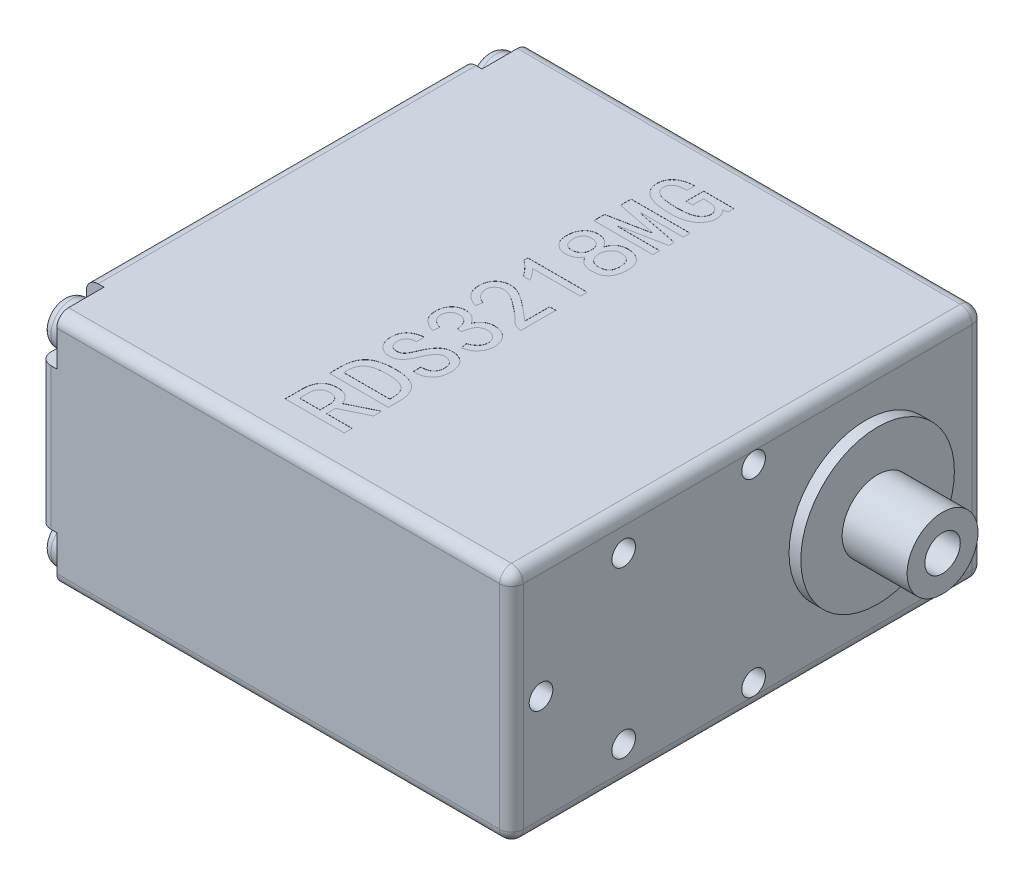
from build123d import *

# Parameters (mm, degrees)
SKETCH_1_W          = 40
SKETCH_1_H          = 40
EXTRUDE_1_DEPTH     = 20
SKETCH_3_R          = 6.5
EXTRUDE_2_DEPTH     = 1
SKETCH_4_R          = 3
EXTRUDE_3_DEPTH     = 5.5
SKETCH_5_R          = 1.5
CUT_EXTRUDE_2_DEPTH = 3.5
SKETCH_6_W          = 4
SKETCH_6_H          = 4
CUT_EXTRUDE_3_DEPTH = 1.5
FILLET_1_R          = 2
EXTRUDE_START       = -41
SKETCH_3_2_R        = 6.5
EXTRUDE_4_DEPTH     = 41
SKETCH_7_R          = 1
CUT_EXTRUDE_4_DEPTH = 5
EXTRUDE_START_2     = -46
SKETCH_4_2_R        = 3
EXTRUDE_5_DEPTH     = 46
CUT_EXTRUDE_START   = -4
SKETCH_8_R          = 1.5
CUT_EXTRUDE_5_DEPTH = 4
SKETCH_9_R          = 1.75
EXTRUDE_6_DEPTH     = 1.5
FILLET_3_R          = 0.75
FILLET_4_R          = 1
CUT_EXTRUDE_6_DEPTH = 0.01
CUT_EXTRUDE_START_2 = -5
SKETCH_11_R         = 1
CUT_EXTRUDE_7_DEPTH = 5


with BuildPart() as part:
    # 草图1 → 凸台-拉伸1 (new body)
    with BuildSketch(Plane(origin=(0, 0, 0), x_dir=(1, 0, 0), z_dir=(0, 1, 0))):
        Rectangle(SKETCH_1_W, SKETCH_1_H)
    extrude(amount=EXTRUDE_1_DEPTH)

    # 草图3 → 凸台-拉伸2 (add)
    with BuildSketch(Plane(origin=(20, 0, 0), x_dir=(0, 0, -1), z_dir=(1, 0, 0))):
        with Locations(Location((10, 10, 0), (0, 0, 180))):
            Circle(SKETCH_3_R)
    extrude(amount=EXTRUDE_2_DEPTH)

    # 草图4 → 凸台-拉伸3 (add)
    with BuildSketch(Plane(origin=(21, 0, 0), x_dir=(0, 0, -1), z_dir=(1, 0, 0))):
        with Locations((10, 10)):
            Circle(SKETCH_4_R)
    extrude(amount=EXTRUDE_3_DEPTH)

    # 草图5 → 切除-拉伸2 (cut)
    with BuildSketch(Plane(origin=(26.5, 0, 0), x_dir=(0, 0, -1), z_dir=(1, 0, 0))):
        with Locations((10, 10)):
            Circle(SKETCH_5_R)
    extrude(amount=-CUT_EXTRUDE_2_DEPTH, mode=Mode.SUBTRACT)

    # 草图6 → 切除-拉伸3 (cut)
    with BuildSketch(Plane.ZY.offset(20)):
        with Locations((18, 18)):
            Rectangle(SKETCH_6_W, SKETCH_6_H)
        with Locations((-18, 18)):
            Rectangle(SKETCH_6_W, SKETCH_6_H)
        with Locations((-18, 2)):
            Rectangle(SKETCH_6_W, SKETCH_6_H)
        with Locations((18, 2)):
            Rectangle(SKETCH_6_W, SKETCH_6_H)
    extrude(amount=-CUT_EXTRUDE_3_DEPTH, mode=Mode.SUBTRACT)

    # 圆角1
    fillet_1_edges = [part.edges().sort_by_distance(p)[0] for p in [
        (-19.25, 16, -16),
        (-19.25, 4, 16),
        (-19.25, 4, -16),
        (-19.25, 16, 16),
    ]]
    fillet(fillet_1_edges, radius=FILLET_1_R)

    # 草图3<2> → 凸台-拉伸4 (add)
    with BuildSketch(Plane(origin=(20, 0, 0), x_dir=(0, 0, -1), z_dir=(1, 0, 0)).offset(EXTRUDE_START)):
        with Locations(Location((10, 10, 0), (0, 0, 180))):
            Circle(SKETCH_3_2_R)
    extrude(amount=EXTRUDE_4_DEPTH)

    # 草图7 → 切除-拉伸4 (cut)
    with BuildSketch(Plane.ZY.offset(20)):
        with Locations(Location((-0.5, 18, 0), (0, 0, 180))):
            Circle(SKETCH_7_R)
        with Locations((17.5, 10)):
            Circle(SKETCH_7_R)
        with Locations((10.5, 17)):
            Circle(SKETCH_7_R)
        with Locations((-0.5, 2)):
            Circle(SKETCH_7_R)
        with Locations(Location((10.5, 3, 0), (0, 0, 180))):
            Circle(SKETCH_7_R)
    extrude(amount=-CUT_EXTRUDE_4_DEPTH, mode=Mode.SUBTRACT)

    # 草图4<2> → 凸台-拉伸5 (add)
    with BuildSketch(Plane(origin=(21, 0, 0), x_dir=(0, 0, -1), z_dir=(1, 0, 0)).offset(EXTRUDE_START_2)):
        with Locations((10, 10)):
            Circle(SKETCH_4_2_R)
    extrude(amount=EXTRUDE_5_DEPTH)

    # 草图8 → 切除-拉伸5 (cut)
    with BuildSketch(Plane.ZY.offset(25).offset(CUT_EXTRUDE_START)):
        with Locations(Location((-10, 10, 0), (0, 0, 180))):
            Circle(SKETCH_8_R)
    extrude(amount=CUT_EXTRUDE_5_DEPTH, mode=Mode.SUBTRACT)

    # 草图9 → 凸台-拉伸6 (add)
    with BuildSketch(Plane.ZY.offset(18.5)):
        with Locations(Location((-18, 18, 0), (0, 0, 180))):
            Circle(SKETCH_9_R)
        with Locations(Location((-18, 2, 0), (0, 0, 180))):
            Circle(SKETCH_9_R)
        with Locations(Location((18, 2, 0), (0, 0, 180))):
            Circle(SKETCH_9_R)
        with Locations(Location((18, 18, 0), (0, 0, 180))):
            Circle(SKETCH_9_R)
    extrude(amount=EXTRUDE_6_DEPTH)

    # 圆角3
    fillet_3_edges = [part.edges().sort_by_distance(p)[0] for p in [
        (-20, 18, -16.25),
        (-20, 2, -16.25),
        (-20, 2, 19.75),
        (-20, 18, 19.75),
    ]]
    fillet(fillet_3_edges, radius=FILLET_3_R)

    # 圆角4
    fillet_4_edges = [part.edges().sort_by_distance(p)[0] for p in [
        (0.75, 0, 20),
        (-20, 0, 0),
        (-20, 20, 0),
        (0.75, 20, 20),
        (-20, 10, 20),
        (-20, 10, -20),
        (20, 20, 0),
        (0.75, 0, -20),
        (20, 0, 0),
        (0.75, 20, -20),
        (20, 10, 20),
        (20, 10, -20),
    ]]
    fillet(fillet_4_edges, radius=FILLET_4_R - 0.0001)  # a hair under: the kernel refuses the full size

    # 草图10 → 切除-拉伸6 (cut)
    # profile 1 of 9: a face of its own
    with BuildSketch(Plane(origin=(0, 20, 0), x_dir=(1, 0, 0), z_dir=(0, 1, 0))):
        with BuildLine():
            Line((2.35380117, -13.333333333), (2.35380117, -14.035087719))
            Line((2.35380117, -14.035087719), (0.19005848, -15.087719298))
            Line((0.19005848, -15.087719298), (0.19005848, -15.847953216))
            Line((0.19005848, -15.847953216), (2.35380117, -15.847953216))
            Line((2.35380117, -15.847953216), (2.35380117, -16.520467836))
            Line((2.35380117, -16.520467836), (-2.64619883, -16.520467836))
            Line((-2.64619883, -16.520467836), (-2.64619883, -15.058479532))
            add(Edge.make_bspline(
                [(-2.64619883, -15.058479532), (-2.645066198, -15.001417536), (-2.642847015, -14.88961512), (-2.628216129, -14.725857534), (-2.60076945, -14.570699353), (-2.563921503, -14.423736755), (-2.517830493, -14.284631505), (-2.459967458, -14.153843609), (-2.391750222, -14.031104197), (-2.312793325, -13.916867195), (-2.222078827, -13.812934167), (-2.116562598, -13.723592122), (-1.998633781, -13.646805994), (-1.86677698, -13.585513412), (-1.72205374, -13.537752248), (-1.564232247, -13.503367145), (-1.393046397, -13.482767178), (-1.274515513, -13.480632114), (-1.213450292, -13.479532164)],
                knots=[0, 0, 0, 0, 1.124630092, 2.203504408, 3.23628662, 4.226715629, 5.187363728, 6.120646134, 7.041068246, 7.950871023, 8.853048098, 9.751261271, 10.666886757, 11.618456078, 12.60834836, 13.664751565, 14.796917252, 16, 16, 16, 16], degree=3))
            add(Edge.make_bspline(
                [(-1.213450292, -13.479532164), (-1.166121865, -13.48022125), (-1.073769469, -13.48156587), (-0.939504453, -13.496127483), (-0.813445664, -13.518511456), (-0.695494663, -13.549827176), (-0.585670205, -13.590688468), (-0.484439599, -13.642258608), (-0.390710508, -13.701512797), (-0.27965188, -13.792391704), (-0.159447869, -13.917911637), (-0.040468237, -14.081787414), (0.049701913, -14.257491627), (0.084854111, -14.382342379), (0.102339181, -14.444444444)],
                knots=[0, 0, 0, 0, 0.960252019, 1.873748618, 2.737466876, 3.556786617, 4.347431233, 5.110891588, 5.858830743, 6.593445102, 8.018399741, 9.372640647, 10.693124067, 12, 12, 12, 12], degree=3))
            Line((0.102339181, -14.444444444), (2.35380117, -13.333333333))
        make_face()
        with BuildLine():
            add(Edge.make_bspline(
                [(-1.213450292, -14.152046784), (-1.246682501, -14.153044192), (-1.311517879, -14.154990115), (-1.40628781, -14.165326916), (-1.495081675, -14.184974683), (-1.57880875, -14.211992032), (-1.656320325, -14.248268559), (-1.729981475, -14.289848941), (-1.79618772, -14.342134507), (-1.858466405, -14.400302894), (-1.914187461, -14.467550402), (-1.960853018, -14.545455285), (-2.002289841, -14.63138005), (-2.033997711, -14.728102137), (-2.060767511, -14.833232476), (-2.076405078, -14.948776312), (-2.089718369, -15.073337123), (-2.090327756, -15.159873101), (-2.090643275, -15.204678363)],
                knots=[0, 0, 0, 0, 1.018570254, 1.987210327, 2.915804621, 3.800751041, 4.676804698, 5.534297136, 6.386063351, 7.254542914, 8.142525653, 9.051209436, 10.030838938, 11.059211408, 12.164478139, 13.350221964, 14.628038851, 16, 16, 16, 16], degree=3))
            Line((-2.090643275, -15.204678363), (-2.090643275, -15.847953216))
            Line((-2.090643275, -15.847953216), (-0.365497076, -15.847953216))
            Line((-0.365497076, -15.847953216), (-0.365497076, -15.029239766))
            add(Edge.make_bspline(
                [(-0.365497076, -15.029239766), (-0.367682863, -14.972375244), (-0.371961019, -14.861076479), (-0.408561283, -14.699995634), (-0.469374047, -14.550397153), (-0.537978064, -14.43513158), (-0.606367302, -14.351854594), (-0.668180836, -14.298912037), (-0.737022381, -14.252190422), (-0.81600611, -14.216050211), (-0.902999543, -14.186509981), (-0.99896802, -14.166316218), (-1.103417182, -14.154590017), (-1.175876201, -14.152915247), (-1.213450292, -14.152046784)],
                knots=[0, 0, 0, 0, 1.472377943, 2.88182931, 4.254250842, 5.643689461, 6.340829676, 7.036964823, 7.745313799, 8.490218866, 9.280116125, 10.122350202, 11.026332609, 12, 12, 12, 12], degree=3))
        make_face(mode=Mode.SUBTRACT)
    # profile 2 of 9: a face of its own
    with BuildSketch(Plane(origin=(0, 20, 0), x_dir=(1, 0, 0), z_dir=(0, 1, 0))):
        with BuildLine():
            add(Edge.make_bspline(
                [(-0.131578947, -9.678362573), (-0.023577985, -9.679780731), (0.184848114, -9.682517569), (0.485455921, -9.71024761), (0.76236218, -9.753162291), (1.014962479, -9.815989188), (1.243581941, -9.895387348), (1.448299187, -9.99296932), (1.629215559, -10.109052702), (1.784721025, -10.245156151), (1.919973898, -10.394710464), (2.036411963, -10.556857624), (2.134245795, -10.731448581), (2.214795848, -10.917957904), (2.27775706, -11.116755185), (2.32147745, -11.328330592), (2.349429023, -11.551845477), (2.352321907, -11.705205676), (2.35380117, -11.783625731)],
                knots=[0, 0, 0, 0, 1.389657691, 2.681836576, 3.8817881, 4.992838363, 6.027306203, 6.991498475, 7.90517149, 8.78454697, 9.643055887, 10.495319185, 11.348215431, 12.21388539, 13.105788495, 14.027025635, 14.991128354, 16, 16, 16, 16], degree=3))
            Line((2.35380117, -11.783625731), (2.35380117, -12.777777778))
            Line((2.35380117, -12.777777778), (-2.64619883, -12.777777778))
            Line((-2.64619883, -12.777777778), (-2.64619883, -11.783625731))
            add(Edge.make_bspline(
                [(-2.64619883, -11.783625731), (-2.644869431, -11.696177373), (-2.642296474, -11.526927372), (-2.613114569, -11.282510096), (-2.568620109, -11.055695287), (-2.504704159, -10.846527583), (-2.422775377, -10.654576328), (-2.321024538, -10.481150784), (-2.202753809, -10.324161201), (-2.062896976, -10.186366574), (-1.902800454, -10.064524022), (-1.718954316, -9.96052171), (-1.511462849, -9.873388174), (-1.28136339, -9.800820191), (-1.027032006, -9.746543263), (-0.749840186, -9.707428888), (-0.448645745, -9.681640688), (-0.239931227, -9.679482814), (-0.131578947, -9.678362573)],
                knots=[0, 0, 0, 0, 1.107747103, 2.143964784, 3.114763989, 4.033695075, 4.910753596, 5.753467216, 6.57607144, 7.394530573, 8.233597708, 9.118827463, 10.063766083, 11.080943166, 12.172147419, 13.355508743, 14.627135957, 16, 16, 16, 16], degree=3))
        make_face()
        with BuildLine():
            add(Edge.make_bspline(
                [(-0.131578947, -10.380116959), (-0.218237435, -10.38111375), (-0.385220364, -10.383034475), (-0.626086424, -10.398812973), (-0.846560545, -10.426998261), (-1.047759136, -10.463942891), (-1.228075597, -10.513528553), (-1.389433753, -10.572459765), (-1.530225594, -10.644024539), (-1.652311582, -10.726936665), (-1.756527104, -10.821632279), (-1.846483809, -10.926760749), (-1.922182862, -11.043033022), (-1.984880989, -11.170120005), (-2.031714575, -11.308343356), (-2.066758482, -11.456922813), (-2.0873857, -11.616630383), (-2.089536538, -11.726890313), (-2.090643275, -11.783625731)],
                knots=[0, 0, 0, 0, 1.502629547, 2.895428823, 4.182716366, 5.355134258, 6.439418811, 7.421876653, 8.328913812, 9.170986823, 9.973119587, 10.763417097, 11.563789401, 12.372828843, 13.214157028, 14.088710487, 15.016525688, 16, 16, 16, 16], degree=3))
            Line((-2.090643275, -11.783625731), (-2.090643275, -12.105263158))
            Line((-2.090643275, -12.105263158), (1.798245614, -12.105263158))
            Line((1.798245614, -12.105263158), (1.798245614, -11.783625731))
            add(Edge.make_bspline(
                [(1.798245614, -11.783625731), (1.797037417, -11.726900309), (1.794690361, -11.616704886), (1.77547297, -11.456986095), (1.741514454, -11.30838016), (1.695603378, -11.17040291), (1.635112532, -11.043472693), (1.562980154, -10.9265082), (1.475018571, -10.822057849), (1.374311069, -10.727281394), (1.256212201, -10.64374175), (1.11822836, -10.571969558), (0.959017125, -10.513994768), (0.780757536, -10.463533345), (0.581566556, -10.427180458), (0.362233175, -10.398635855), (0.122056884, -10.383071347), (-0.044922368, -10.381126348), (-0.131578947, -10.380116959)],
                knots=[0, 0, 0, 0, 0.990994579, 1.925116862, 2.804934476, 3.650652139, 4.460393816, 5.25668448, 6.044890256, 6.839230022, 7.667046998, 8.564215713, 9.54828102, 10.622625477, 11.79781265, 13.082430897, 14.485880397, 16, 16, 16, 16], degree=3))
        make_face(mode=Mode.SUBTRACT)
    # profile 3 of 9: a face of its own
    with BuildSketch(Plane(origin=(0, 20, 0), x_dir=(1, 0, 0), z_dir=(0, 1, 0))):
        with BuildLine():
            add(Edge.make_bspline(
                [(0.950292398, -5.964912281), (1.00485854, -5.96611488), (1.111466606, -5.968464446), (1.267472591, -5.988166817), (1.414760107, -6.021503035), (1.553448077, -6.06825243), (1.683094542, -6.128100931), (1.804424941, -6.200953946), (1.91633904, -6.288289738), (2.018952876, -6.388180434), (2.112355229, -6.498191143), (2.19303605, -6.619206579), (2.259934873, -6.750502322), (2.316857499, -6.890417298), (2.35986733, -7.040408842), (2.389890431, -7.199945885), (2.408513647, -7.368702801), (2.411006417, -7.484609197), (2.412280702, -7.543859649)],
                knots=[0, 0, 0, 0, 1.076259056, 2.102730573, 3.09615591, 4.05107809, 4.984729369, 5.908110826, 6.836941787, 7.778787535, 8.728970618, 9.679073625, 10.641034314, 11.631596305, 12.654875673, 13.713625689, 14.831223164, 16, 16, 16, 16], degree=3))
            add(Edge.make_bspline(
                [(2.412280702, -7.543859649), (2.411118334, -7.603120113), (2.408850742, -7.718727644), (2.38878598, -7.88674787), (2.357655679, -8.045189145), (2.3139041, -8.194014781), (2.2549891, -8.332074593), (2.183677057, -8.459782074), (2.101938164, -8.57922208), (2.004586978, -8.685119052), (1.900584886, -8.782271632), (1.786821893, -8.864048438), (1.668559855, -8.935622207), (1.542930542, -8.992730237), (1.411659678, -9.03917607), (1.273013844, -9.069588416), (1.128510581, -9.090121752), (1.029783608, -9.092405061), (0.979532164, -9.093567251)],
                knots=[0, 0, 0, 0, 1.196484868, 2.334147444, 3.412243803, 4.454848227, 5.460999767, 6.436818592, 7.405612426, 8.376187812, 9.335968902, 10.275091469, 11.200357791, 12.123553648, 13.057369033, 14.007128931, 14.985640427, 16, 16, 16, 16], degree=3))
            Line((0.979532164, -9.093567251), (0.774853801, -9.093567251))
            Line((0.774853801, -9.093567251), (0.774853801, -8.421052632))
            Line((0.774853801, -8.421052632), (0.950292398, -8.421052632))
            add(Edge.make_bspline(
                [(0.950292398, -8.421052632), (0.985698023, -8.420147541), (1.054908927, -8.418378271), (1.155425702, -8.406781459), (1.249766199, -8.386069145), (1.337249456, -8.357023599), (1.4187542, -8.31984787), (1.493437116, -8.274173623), (1.562626415, -8.220916991), (1.643542975, -8.138666558), (1.728934814, -8.025256564), (1.802805101, -7.874583404), (1.849618032, -7.71305959), (1.854331152, -7.600853757), (1.856725146, -7.543859649)],
                knots=[0, 0, 0, 0, 0.89970853, 1.758749939, 2.566656616, 3.349866332, 4.096893782, 4.837870496, 5.569993442, 6.309435511, 7.764284211, 9.154994143, 10.554900695, 12, 12, 12, 12], degree=3))
            add(Edge.make_bspline(
                [(1.856725146, -7.543859649), (1.855714381, -7.506301565), (1.853746926, -7.433194718), (1.843733681, -7.327225283), (1.823769383, -7.229141747), (1.797655303, -7.138586208), (1.760654892, -7.056921572), (1.719404916, -6.981256191), (1.667599464, -6.914684931), (1.589742934, -6.8377836), (1.481175834, -6.756534603), (1.334710767, -6.68810274), (1.175798739, -6.645084756), (1.065364738, -6.640021571), (1.00877193, -6.637426901)],
                knots=[0, 0, 0, 0, 0.962440328, 1.873391043, 2.722138851, 3.523734004, 4.281456455, 5.014396504, 5.726506092, 6.432706956, 7.814287824, 9.175195494, 10.55240578, 12, 12, 12, 12], degree=3))
            add(Edge.make_bspline(
                [(1.00877193, -6.637426901), (0.984535944, -6.638321778), (0.936495508, -6.640095599), (0.864891644, -6.652538514), (0.794582363, -6.672804115), (0.72606315, -6.70293156), (0.658379078, -6.739349847), (0.593437366, -6.786165217), (0.528032445, -6.83861447), (0.442556664, -6.924003205), (0.339020088, -7.050093624), (0.223658349, -7.227045396), (0.112980987, -7.432538058), (0.048455468, -7.582291642), (0.014619883, -7.660818713)],
                knots=[0, 0, 0, 0, 0.578138014, 1.145981947, 1.729294273, 2.319686506, 2.928759201, 3.559612696, 4.226874004, 4.927334085, 6.438251822, 8.110552943, 9.960470262, 12, 12, 12, 12], degree=3))
            add(Edge.make_bspline(
                [(0.014619883, -7.660818713), (-0.007413061, -7.717272088), (-0.050196092, -7.826891868), (-0.118263453, -7.984293858), (-0.188572515, -8.129059675), (-0.259747086, -8.262342254), (-0.334452161, -8.382045147), (-0.410204365, -8.490263285), (-0.488379395, -8.585467988), (-0.567277334, -8.670325205), (-0.651027636, -8.741873847), (-0.736146032, -8.805885189), (-0.827006101, -8.857393596), (-0.920155764, -8.901268775), (-1.017390163, -8.935264017), (-1.118412192, -8.958386413), (-1.22302232, -8.974853892), (-1.294244549, -8.976017392), (-1.330409357, -8.976608187)],
                knots=[0, 0, 0, 0, 1.442752318, 2.801501104, 4.081506638, 5.273637195, 6.396923968, 7.438988766, 8.41619664, 9.328106494, 10.193211603, 11.035517752, 11.859560831, 12.674726742, 13.484711172, 14.306060706, 15.139861387, 16, 16, 16, 16], degree=3))
            add(Edge.make_bspline(
                [(-1.330409357, -8.976608187), (-1.380284474, -8.975377993), (-1.478262293, -8.972961322), (-1.621730455, -8.953423084), (-1.757763822, -8.919681471), (-1.886403921, -8.873076414), (-2.007564401, -8.81287286), (-2.121712644, -8.7401068), (-2.228798605, -8.653970415), (-2.32612389, -8.554577048), (-2.414370853, -8.446563007), (-2.493088201, -8.333109871), (-2.55800361, -8.213322442), (-2.611257311, -8.088881067), (-2.654171435, -7.960128601), (-2.68257172, -7.825658162), (-2.702321989, -7.68667463), (-2.703885017, -7.591942723), (-2.704678363, -7.543859649)],
                knots=[0, 0, 0, 0, 1.07870255, 2.119071136, 3.124805643, 4.105581286, 5.072990272, 6.045680189, 7.028691787, 8.039235481, 9.049145311, 10.043383937, 11.021887354, 11.990902522, 12.968844852, 13.952259623, 14.960628413, 16, 16, 16, 16], degree=3))
            add(Edge.make_bspline(
                [(-2.704678363, -7.543859649), (-2.703083565, -7.482805017), (-2.699988318, -7.36430774), (-2.680226812, -7.193274654), (-2.644116665, -7.035471601), (-2.594664834, -6.891162209), (-2.531411981, -6.759095893), (-2.453710418, -6.640480594), (-2.359864682, -6.53622945), (-2.253597636, -6.445989702), (-2.13916413, -6.368207311), (-2.021751086, -6.299782766), (-1.902859991, -6.240504808), (-1.780662385, -6.194220659), (-1.65689007, -6.157278217), (-1.530720648, -6.129436609), (-1.401881322, -6.114627277), (-1.315281091, -6.112284089), (-1.271929825, -6.111111111)],
                knots=[0, 0, 0, 0, 1.28200282, 2.488162422, 3.607876601, 4.67451564, 5.684699519, 6.674808952, 7.640986039, 8.619275895, 9.594772521, 10.542429609, 11.471197476, 12.380494384, 13.282146407, 14.18153381, 15.089692832, 16, 16, 16, 16], degree=3))
            Line((-1.271929825, -6.111111111), (-1.271929825, -6.783625731))
            add(Edge.make_bspline(
                [(-1.271929825, -6.783625731), (-1.324389139, -6.781468195), (-1.427721868, -6.777218347), (-1.580618678, -6.808500188), (-1.725651683, -6.868000385), (-1.837506635, -6.94078496), (-1.919158232, -7.011373105), (-1.972590761, -7.071743361), (-2.018248401, -7.136650001), (-2.05591827, -7.207501909), (-2.084702391, -7.283977545), (-2.105459109, -7.366058563), (-2.117257973, -7.453269895), (-2.11899288, -7.513140654), (-2.119883041, -7.543859649)],
                knots=[0, 0, 0, 0, 1.460277153, 2.876408615, 4.312700685, 5.812754337, 6.576349981, 7.318184748, 8.055769063, 8.785612399, 9.550601407, 10.329777546, 11.143028139, 12, 12, 12, 12], degree=3))
            add(Edge.make_bspline(
                [(-2.119883041, -7.543859649), (-2.117912687, -7.599689601), (-2.114156338, -7.706125697), (-2.077156908, -7.856386377), (-2.019108835, -7.98968196), (-1.934326459, -8.102305581), (-1.829935851, -8.193079686), (-1.707240157, -8.258806495), (-1.567676217, -8.297143337), (-1.469271557, -8.301716698), (-1.418128655, -8.304093567)],
                knots=[0, 0, 0, 0, 1.145196218, 2.183240533, 3.159303635, 4.113187715, 5.054501613, 5.980375362, 6.950360008, 8, 8, 8, 8], degree=3))
            add(Edge.make_bspline(
                [(-1.418128655, -8.304093567), (-1.375700361, -8.302409529), (-1.292581739, -8.299110435), (-1.172951859, -8.267588439), (-1.062618693, -8.216846833), (-0.97690663, -8.157567914), (-0.912807751, -8.092846525), (-0.861913417, -8.028047387), (-0.809403008, -7.947041753), (-0.75283445, -7.851016604), (-0.696615488, -7.737638923), (-0.635166794, -7.610139516), (-0.574191817, -7.465373045), (-0.533201182, -7.363426583), (-0.511695906, -7.30994152)],
                knots=[0, 0, 0, 0, 1.054599539, 2.066000132, 3.055236876, 4.067595311, 4.639532213, 5.317449549, 6.115078722, 7.04144999, 8.090482295, 9.264325581, 10.564759249, 12, 12, 12, 12], degree=3))
            add(Edge.make_bspline(
                [(-0.511695906, -7.30994152), (-0.489755884, -7.257762352), (-0.446721819, -7.155415974), (-0.37591494, -7.008182126), (-0.303081676, -6.869067852), (-0.224490791, -6.741014846), (-0.145735138, -6.620389737), (-0.062008935, -6.510127938), (0.024243394, -6.408031824), (0.114322527, -6.315699418), (0.207354659, -6.233091816), (0.303660359, -6.160934423), (0.404352753, -6.101457799), (0.506775412, -6.050940109), (0.613440262, -6.013078317), (0.722356154, -5.984556711), (0.835350808, -5.967960475), (0.911613805, -5.965938018), (0.950292398, -5.964912281)],
                knots=[0, 0, 0, 0, 1.28605471, 2.522520843, 3.711463364, 4.852377266, 5.935318125, 6.983656505, 7.996177383, 8.970703677, 9.912147403, 10.821044325, 11.700288743, 12.566114681, 13.412010411, 14.26751643, 15.121329739, 16, 16, 16, 16], degree=3))
        make_face()
    # profile 4 of 9: a face of its own
    with BuildSketch(Plane(origin=(0, 20, 0), x_dir=(1, 0, 0), z_dir=(0, 1, 0))):
        with BuildLine():
            Line((1.067251462, -5.321637427), (0.979532164, -4.795321637))
            add(Edge.make_bspline(
                [(0.979532164, -4.795321637), (1.040853083, -4.77458413), (1.161295636, -4.733852869), (1.327486639, -4.645680714), (1.477782778, -4.541050374), (1.588777988, -4.438737427), (1.666729063, -4.348632281), (1.71726486, -4.276648122), (1.758371928, -4.200080093), (1.792460809, -4.119777769), (1.817000647, -4.034595966), (1.834538636, -3.945867524), (1.843187751, -3.85297639), (1.842552646, -3.75772343), (1.836042517, -3.662592155), (1.818507918, -3.57065777), (1.791362964, -3.483921341), (1.755498343, -3.402137952), (1.710613007, -3.325316234), (1.656199122, -3.253946739), (1.592967593, -3.18710736), (1.520585208, -3.127556227), (1.443048364, -3.073608141), (1.362004123, -3.02695469), (1.278271938, -2.988758991), (1.191516928, -2.959311434), (1.102032249, -2.93753022), (1.009500324, -2.924951081), (0.914607187, -2.919110144), (0.818620832, -2.922839376), (0.723587996, -2.933056188), (0.632845465, -2.952352255), (0.547724184, -2.980305819), (0.466669657, -3.012585156), (0.393230385, -3.057122832), (0.324231957, -3.107285436), (0.259692152, -3.164442993), (0.202298297, -3.231863899), (0.148592269, -3.306784728), (0.100815145, -3.392857104), (0.057150423, -3.489104746), (0.015527629, -3.59505535), (-0.019684698, -3.712293549), (-0.052029928, -3.839433341), (-0.080334432, -3.977472679), (-0.094839944, -4.073276951), (-0.102339181, -4.122807018)],
                knots=[0, 0, 0, 0, 1.855078653, 3.643624569, 5.376586594, 7.099238453, 7.958802739, 8.792187672, 9.617290314, 10.448418756, 11.290832904, 12.156307055, 13.040730742, 13.962699908, 14.887516369, 15.77333433, 16.641593851, 17.490416695, 18.330790169, 19.188542279, 20.060501787, 20.965080398, 21.873151946, 22.768728957, 23.644924134, 24.509778096, 25.394201783, 26.283465696, 27.186203618, 28.119049805, 29.036526799, 29.926454184, 30.774960904, 31.606089347, 32.423351114, 33.231435438, 34.053018946, 34.890129815, 35.76681476, 36.694527615, 37.709623907, 38.798474327, 39.958427676, 41.219700661, 42.562606768, 44, 44, 44, 44], degree=3))
            Line((-0.102339181, -4.122807018), (-0.48245614, -4.122807018))
            add(Edge.make_bspline(
                [(-0.48245614, -4.122807018), (-0.487516128, -4.073251238), (-0.497310882, -3.977324785), (-0.523255395, -3.839475074), (-0.552474258, -3.711811329), (-0.589599866, -3.594893926), (-0.632857019, -3.488332781), (-0.682008335, -3.391702359), (-0.739035669, -3.306193061), (-0.802047005, -3.231180783), (-0.870547809, -3.16558538), (-0.944524899, -3.110237664), (-1.023201527, -3.064088441), (-1.107255194, -3.028056183), (-1.19651878, -3.002651898), (-1.290316911, -2.98440715), (-1.389553119, -2.979053083), (-1.491347971, -2.980812291), (-1.592435081, -2.992073615), (-1.687993202, -3.014888277), (-1.776490988, -3.04735127), (-1.857917244, -3.090021636), (-1.931779851, -3.143408885), (-1.998396402, -3.206820464), (-2.057253692, -3.280094112), (-2.107535735, -3.36222504), (-2.149348693, -3.449730603), (-2.180589354, -3.540299419), (-2.203419097, -3.631530575), (-2.211905558, -3.724775769), (-2.214276215, -3.819162001), (-2.202304303, -3.914924144), (-2.181705757, -4.01215967), (-2.150697784, -4.110240554), (-2.106996584, -4.207834061), (-2.043804921, -4.299281078), (-1.964580453, -4.385322091), (-1.869758442, -4.466772146), (-1.758082053, -4.54233785), (-1.63099219, -4.613727463), (-1.487278204, -4.680158408), (-1.384151092, -4.717422824), (-1.330409357, -4.736842105)],
                knots=[0, 0, 0, 0, 1.384904895, 2.680797605, 3.898481124, 5.025753962, 6.088535907, 7.094446959, 8.035691871, 8.940735056, 9.814263137, 10.667710111, 11.504637003, 12.345769282, 13.203634476, 14.081938957, 14.997613137, 15.961715347, 16.911967593, 17.820346329, 18.687619951, 19.527492825, 20.369044487, 21.214182322, 22.078195068, 22.975407077, 23.887109161, 24.769878753, 25.636861724, 26.495079393, 27.368665175, 28.257920369, 29.171665826, 30.130630594, 31.114502293, 32.133754395, 33.206966894, 34.360276363, 35.602386471, 36.951150767, 38.411179701, 40, 40, 40, 40], degree=3))
            Line((-1.330409357, -4.736842105), (-1.418128655, -5.263157895))
            add(Edge.make_bspline(
                [(-1.418128655, -5.263157895), (-1.50285585, -5.23255113), (-1.667648742, -5.173021515), (-1.899176519, -5.060340934), (-2.108901566, -4.931714425), (-2.266826242, -4.809747201), (-2.38024021, -4.703042261), (-2.453174751, -4.614438222), (-2.519978781, -4.520993956), (-2.573675278, -4.418432957), (-2.623022729, -4.311185259), (-2.658777621, -4.195516433), (-2.687136693, -4.073932299), (-2.706233064, -3.947147048), (-2.716386932, -3.819419134), (-2.720503692, -3.693909022), (-2.714195482, -3.572450382), (-2.703410731, -3.45467399), (-2.682314937, -3.341464037), (-2.654098062, -3.232531824), (-2.618456961, -3.127471153), (-2.575244782, -3.026685612), (-2.524696032, -2.931639206), (-2.46704772, -2.843858248), (-2.403850118, -2.762548186), (-2.333762123, -2.689335832), (-2.256873163, -2.623268143), (-2.173278433, -2.565460093), (-2.08457911, -2.512490792), (-1.988924829, -2.470042146), (-1.889560901, -2.433830142), (-1.786751035, -2.407570425), (-1.682029946, -2.386977791), (-1.574988311, -2.377912716), (-1.465658961, -2.376737502), (-1.354143933, -2.384447158), (-1.240187569, -2.400978176), (-1.124774719, -2.425354125), (-1.009433174, -2.460439852), (-0.897255756, -2.510958597), (-0.788877709, -2.57516873), (-0.68413977, -2.652950159), (-0.583143645, -2.744180214), (-0.487157738, -2.850217613), (-0.393174716, -2.968499453), (-0.336313367, -3.054900226), (-0.307017544, -3.099415205)],
                knots=[0, 0, 0, 0, 2.088305792, 4.061717729, 5.960118031, 7.785667395, 8.679819981, 9.565306567, 10.443279967, 11.338686075, 12.245759712, 13.17780002, 14.140475078, 15.139878761, 16.14808178, 17.111266441, 18.049939504, 18.967196016, 19.852365876, 20.717469786, 21.575331482, 22.422958398, 23.258255538, 24.068719648, 24.855928783, 25.643538544, 26.415460609, 27.202892339, 27.998428211, 28.807767097, 29.626107288, 30.44859165, 31.266374841, 32.098687341, 32.935996238, 33.800370547, 34.688426344, 35.604765293, 36.534282549, 37.478762814, 38.450894383, 39.450613662, 40.499873289, 41.602080565, 42.764555818, 44, 44, 44, 44], degree=3))
            add(Edge.make_bspline(
                [(-0.307017544, -3.099415205), (-0.276197909, -3.034005345), (-0.215772048, -2.905760897), (-0.09185367, -2.735882709), (0.051215644, -2.58790009), (0.189547779, -2.486752306), (0.310022088, -2.4179997), (0.408818634, -2.377402547), (0.514374453, -2.3455473), (0.626495071, -2.32349364), (0.745574275, -2.308951428), (0.871246009, -2.305428343), (1.00368094, -2.309517513), (1.140755816, -2.32391976), (1.278446327, -2.346146552), (1.411318621, -2.382529096), (1.537221358, -2.428925624), (1.656760642, -2.486444059), (1.768249562, -2.557566055), (1.873699408, -2.639145725), (1.972993446, -2.731357913), (2.062884732, -2.83529997), (2.14451907, -2.945626292), (2.21584892, -3.060914285), (2.27365698, -3.180869114), (2.323641987, -3.302896615), (2.358838266, -3.4298954), (2.38422144, -3.559850289), (2.39675333, -3.694025222), (2.399005857, -3.830185023), (2.39008011, -3.965897036), (2.372301225, -4.098623452), (2.342337541, -4.226140421), (2.305061051, -4.350287468), (2.254478061, -4.46845784), (2.196542905, -4.583362837), (2.125827411, -4.691837529), (2.047866418, -4.796786406), (1.958835318, -4.894610498), (1.859717443, -4.983175938), (1.752479565, -5.064795533), (1.633041509, -5.132827928), (1.506114872, -5.195982065), (1.368125324, -5.246697388), (1.221535497, -5.291143284), (1.119446966, -5.311321018), (1.067251462, -5.321637427)],
                knots=[0, 0, 0, 0, 1.557114555, 3.052923452, 4.512541953, 5.983154409, 6.732881782, 7.500995393, 8.282110219, 9.108513416, 9.963529293, 10.867588124, 11.818354446, 12.820472793, 13.839758526, 14.824163732, 15.787764911, 16.731807427, 17.680465688, 18.635497699, 19.605405708, 20.598981779, 21.596001798, 22.564501398, 23.518961515, 24.46633988, 25.40571168, 26.357402795, 27.319996089, 28.309319355, 29.292707151, 30.252143978, 31.194996855, 32.116404031, 33.045091025, 33.964751706, 34.88951078, 35.835094381, 36.78343283, 37.737543287, 38.700262624, 39.68479108, 40.698496387, 41.755992226, 42.852690736, 44, 44, 44, 44], degree=3))
        make_face()
    # profile 5 of 9: a face of its own
    with BuildSketch(Plane(origin=(0, 20, 0), x_dir=(1, 0, 0), z_dir=(0, 1, 0))):
        with BuildLine():
            add(Edge.make_bspline(
                [(2.207602339, -1.520467836), (2.171383898, -1.516930761), (2.099397912, -1.509900644), (1.993497133, -1.485214985), (1.89010043, -1.450480451), (1.789254163, -1.404783216), (1.690917441, -1.348358867), (1.597172337, -1.278955449), (1.503886772, -1.20145456), (1.415716669, -1.108769119), (1.321899694, -1.00883811), (1.214531083, -0.905312228), (1.097240736, -0.793260154), (0.965186118, -0.676629277), (0.822026801, -0.552619503), (0.666516001, -0.42217404), (0.498601542, -0.285751696), (0.321756749, -0.14644124), (0.145009606, -0.008822175), (-0.026284385, 0.117073136), (-0.185341731, 0.232743571), (-0.334410007, 0.334927391), (-0.474459278, 0.422433322), (-0.603309216, 0.498368605), (-0.720672125, 0.563174058), (-0.860845284, 0.627840323), (-1.02250085, 0.688873171), (-1.206147236, 0.736729793), (-1.37610743, 0.758474782), (-1.532295879, 0.749930915), (-1.674807409, 0.716341706), (-1.804174542, 0.657749862), (-1.920694722, 0.575049988), (-2.021135429, 0.470507038), (-2.103267242, 0.350400585), (-2.156651918, 0.21644115), (-2.184863495, 0.073885371), (-2.182093868, -0.07554359), (-2.155869658, -0.226452279), (-2.107236045, -0.375733877), (-2.037200942, -0.521232976), (-1.946794157, -0.66255724), (-1.831124248, -0.793927897), (-1.688432618, -0.909310989), (-1.519717389, -1.007489082), (-1.395066378, -1.05646653), (-1.330409357, -1.081871345)],
                knots=[0, 0, 0, 0, 0.68324931, 1.357992617, 2.038035037, 2.730284322, 3.43541055, 4.164095581, 4.91978436, 5.711285425, 6.565347062, 7.495992796, 8.513340264, 9.613596236, 10.806353808, 12.072750425, 13.427835217, 14.871897714, 16.303429279, 17.63715395, 18.866599259, 19.999315079, 21.032640925, 21.969226408, 22.810037557, 23.550593805, 24.868612452, 26.051607131, 27.110166319, 28.074996885, 28.975023992, 29.846369167, 30.727248145, 31.643566772, 32.557974933, 33.443569333, 34.334964858, 35.271157169, 36.234746795, 37.204430329, 38.211822504, 39.261804213, 40.347978988, 41.485883341, 42.695916775, 44, 44, 44, 44], degree=3))
            Line((-1.330409357, -1.081871345), (-1.418128655, -1.637426901))
            add(Edge.make_bspline(
                [(-1.418128655, -1.637426901), (-1.472512797, -1.617813958), (-1.578320712, -1.579655693), (-1.728969045, -1.513921856), (-1.86926595, -1.446114578), (-1.998259858, -1.373791717), (-2.115723573, -1.296982567), (-2.221324264, -1.215362632), (-2.315750151, -1.130135206), (-2.398746673, -1.040354945), (-2.472258387, -0.94695149), (-2.534364573, -0.847728327), (-2.590116533, -0.746073105), (-2.637127219, -0.640051304), (-2.675112051, -0.529961826), (-2.70271025, -0.415219651), (-2.724127996, -0.297024239), (-2.730626819, -0.216314038), (-2.733918129, -0.175438596)],
                knots=[0, 0, 0, 0, 1.318489008, 2.565206815, 3.747405244, 4.871986395, 5.936312274, 6.946003669, 7.913720337, 8.834395417, 9.732136242, 10.620766564, 11.501424885, 12.375164454, 13.263184087, 14.153948527, 15.065072702, 16, 16, 16, 16], degree=3))
            add(Edge.make_bspline(
                [(-2.733918129, -0.175438596), (-2.737776575, -0.127819755), (-2.745280507, -0.035210324), (-2.746137316, 0.100459314), (-2.739176242, 0.228656743), (-2.721784854, 0.351287687), (-2.69252369, 0.471443889), (-2.646999702, 0.591161034), (-2.587799936, 0.712581666), (-2.516555321, 0.836341534), (-2.425924068, 0.955563447), (-2.314227073, 1.064973481), (-2.181347341, 1.161004675), (-2.03121249, 1.246917685), (-1.862362214, 1.316234679), (-1.674303203, 1.357923035), (-1.470662788, 1.373204869), (-1.291073924, 1.364804543), (-1.138841043, 1.344226969), (-1.016729545, 1.315830724), (-0.889971085, 1.274614109), (-0.756685444, 1.225136111), (-0.619051371, 1.161792623), (-0.475262996, 1.087669262), (-0.326539588, 1.002166386), (-0.198967657, 0.922353982), (-0.092452629, 0.850690898), (-0.004652459, 0.791908701), (0.08752564, 0.724968358), (0.18571926, 0.652776727), (0.289607752, 0.574695239), (0.399329085, 0.491382759), (0.513744118, 0.401360607), (0.634342677, 0.30573788), (0.760911215, 0.204646816), (0.891703066, 0.09552635), (1.029223124, -0.01776306), (1.172515415, -0.13684805), (1.320469423, -0.263024512), (1.47568877, -0.393159396), (1.634547893, -0.531569745), (1.742967635, -0.624919896), (1.798245614, -0.67251462)],
                knots=[0, 0, 0, 0, 0.92421929, 1.797427642, 2.623159043, 3.406557121, 4.19098228, 5.011020959, 5.879578741, 6.803269905, 7.770091595, 8.767910272, 9.81716943, 10.934010526, 12.109247782, 13.334431608, 14.644905237, 16.050386148, 16.805137353, 17.6151175, 18.47230853, 19.383098903, 20.364746325, 21.401984688, 22.512758034, 23.683419128, 24.313078477, 24.997010098, 25.727849061, 26.517235061, 27.355488255, 28.242667054, 29.183111138, 30.172606021, 31.221004473, 32.317541081, 33.468635314, 34.668912549, 35.922892041, 37.231427981, 38.588439115, 40, 40, 40, 40], degree=3))
            Line((1.798245614, -0.67251462), (1.798245614, 1.432748538))
            Line((1.798245614, 1.432748538), (2.324561404, 1.432748538))
            Line((2.324561404, 1.432748538), (2.324561404, -1.520467836))
            Line((2.324561404, -1.520467836), (2.207602339, -1.520467836))
        make_face()
    # profile 6 of 9: a face of its own
    with BuildSketch(Plane(origin=(0, 20, 0), x_dir=(1, 0, 0), z_dir=(0, 1, 0))):
        with BuildLine():
            add(Edge.make_bspline(
                [(-1.710526316, 3.50877193), (-1.646659077, 3.442202396), (-1.515041, 3.30501541), (-1.332159173, 3.074264609), (-1.15077333, 2.819932655), (-1.037717548, 2.637665445), (-0.979532164, 2.543859649)],
                knots=[0, 0, 0, 0, 0.911926792, 1.879305458, 2.908561558, 4, 4, 4, 4], degree=3))
            Line((-0.979532164, 2.543859649), (-1.535087719, 2.543859649))
            add(Edge.make_bspline(
                [(-1.535087719, 2.543859649), (-1.576685823, 2.603891284), (-1.659300469, 2.723115282), (-1.793562217, 2.892403091), (-1.930539639, 3.055479421), (-2.074130049, 3.209697251), (-2.223257299, 3.355841851), (-2.378306502, 3.493076502), (-2.537827129, 3.623221279), (-2.649014003, 3.702833277), (-2.704678363, 3.742690058)],
                knots=[0, 0, 0, 0, 1.040505617, 2.06646444, 3.077497115, 4.074813761, 5.0678894, 6.051715719, 7.024615104, 8, 8, 8, 8], degree=3))
            Line((-2.704678363, 3.742690058), (-2.704678363, 4.093567251))
            Line((-2.704678363, 4.093567251), (2.324561404, 4.093567251))
            Line((2.324561404, 4.093567251), (2.324561404, 3.50877193))
            Line((2.324561404, 3.50877193), (-1.710526316, 3.50877193))
        make_face()
    # profile 7 of 9: a face of its own
    with BuildSketch(Plane(origin=(0, 20, 0), x_dir=(1, 0, 0), z_dir=(0, 1, 0))):
        with BuildLine():
            add(Edge.make_bspline(
                [(0.891812865, 5.81871345), (0.833522425, 5.820694575), (0.716339816, 5.824677275), (0.542421415, 5.860533713), (0.369799983, 5.914344795), (0.230001492, 5.978471663), (0.120954854, 6.040164165), (0.043931318, 6.096541397), (-0.030210608, 6.158399086), (-0.100761297, 6.227389094), (-0.165755043, 6.305333067), (-0.227285184, 6.38958382), (-0.285306664, 6.480877838), (-0.319050053, 6.545826932), (-0.33625731, 6.578947368)],
                knots=[0, 0, 0, 0, 1.373991012, 2.762165668, 4.17374014, 5.63364859, 6.381655157, 7.126259247, 7.882033384, 8.659013064, 9.450791926, 10.273664397, 11.119664557, 12, 12, 12, 12], degree=3))
            add(Edge.make_bspline(
                [(-0.33625731, 6.578947368), (-0.370047584, 6.524688896), (-0.43420379, 6.421670561), (-0.544598061, 6.287593982), (-0.662618231, 6.18391512), (-0.787325788, 6.107747786), (-0.919505426, 6.056610403), (-1.05808499, 6.017362776), (-1.205657622, 5.990427919), (-1.358965626, 5.976838824), (-1.511650569, 5.976158602), (-1.656882021, 5.991107815), (-1.79149145, 6.020054032), (-1.915826683, 6.064012365), (-2.032436153, 6.122698521), (-2.143336391, 6.195070299), (-2.252939991, 6.277153977), (-2.354990918, 6.372798857), (-2.448897777, 6.476023473), (-2.527882687, 6.586906356), (-2.588797779, 6.704226178), (-2.635117235, 6.826775765), (-2.664885744, 6.955331002), (-2.688101396, 7.088349868), (-2.702272522, 7.226598804), (-2.705608717, 7.368401059), (-2.703428087, 7.509118342), (-2.69040592, 7.644515054), (-2.674309506, 7.772843925), (-2.647974761, 7.895909133), (-2.609341645, 8.017220842), (-2.555974908, 8.140590561), (-2.483924702, 8.266082957), (-2.399817118, 8.394988244), (-2.296334502, 8.518253897), (-2.168167975, 8.622607093), (-2.021545989, 8.710254306), (-1.884575909, 8.765566091), (-1.766557934, 8.797971334), (-1.673318765, 8.817059242), (-1.57610126, 8.826178229), (-1.475421008, 8.828828687), (-1.370946263, 8.821201483), (-1.26260579, 8.809035115), (-1.151019338, 8.786518837), (-1.037091488, 8.758015028), (-0.923384043, 8.720566921), (-0.815636114, 8.666622143), (-0.71417857, 8.599757783), (-0.618468523, 8.520748388), (-0.530207124, 8.427087952), (-0.447914835, 8.321048558), (-0.373022486, 8.200831757), (-0.329448928, 8.114578206), (-0.307017544, 8.070175439)],
                knots=[0, 0, 0, 0, 1.410007856, 2.677124032, 3.817993936, 4.862038523, 5.884483771, 6.936313852, 8.038143602, 9.190227958, 10.329677848, 11.403225768, 12.406647263, 13.361799212, 14.306121119, 15.280880793, 16.281704634, 17.324806187, 18.363057426, 19.357900068, 20.320204332, 21.273326694, 22.241550863, 23.227965334, 24.253139258, 25.305421966, 26.357493472, 27.357365266, 28.306214713, 29.21112087, 30.130919593, 31.112332994, 32.171861402, 33.321048816, 34.50769264, 35.707479524, 36.951026444, 38.266452232, 38.952734231, 39.651257905, 40.364042766, 41.105254942, 41.871692901, 42.67422759, 43.510279281, 44.381875916, 45.266344013, 46.146530514, 47.032755608, 47.943815282, 48.879389684, 49.867572645, 50.902240264, 52, 52, 52, 52], degree=3))
            add(Edge.make_bspline(
                [(-0.307017544, 8.070175439), (-0.294612027, 8.110447976), (-0.27051966, 8.188660014), (-0.225725747, 8.299180162), (-0.176661448, 8.400888957), (-0.123575478, 8.494102771), (-0.062676826, 8.576778389), (0.000504882, 8.652254613), (0.070162194, 8.717409512), (0.169892785, 8.791809945), (0.307104758, 8.86665259), (0.487517974, 8.931569668), (0.684451274, 8.968519719), (0.890694671, 8.980264611), (1.093474206, 8.970587786), (1.281263797, 8.949467625), (1.447008483, 8.906737773), (1.591396107, 8.848844681), (1.717902342, 8.779275618), (1.833716734, 8.708758415), (1.938458236, 8.633600702), (2.033323886, 8.553942976), (2.118865153, 8.465123267), (2.192725137, 8.361565547), (2.257985984, 8.243952363), (2.312573437, 8.110773517), (2.359601164, 7.962026671), (2.388997293, 7.794578583), (2.408754237, 7.609339043), (2.414165173, 7.411372905), (2.408570983, 7.211642235), (2.388862224, 7.02135118), (2.358712923, 6.844853114), (2.312640669, 6.683054736), (2.256032217, 6.534332887), (2.18407561, 6.400049086), (2.102764195, 6.276299094), (2.005364446, 6.168139764), (1.898376375, 6.073674967), (1.781655894, 5.994312393), (1.654517943, 5.933928792), (1.519206168, 5.888032008), (1.374562131, 5.857968119), (1.22196827, 5.835319333), (1.059950997, 5.820727679), (0.948880084, 5.819397093), (0.891812865, 5.81871345)],
                knots=[0, 0, 0, 0, 0.834702042, 1.621048771, 2.360065648, 3.071640516, 3.742693432, 4.392085624, 5.019599432, 5.627607977, 6.85386967, 8.100573226, 9.412235126, 10.809716886, 12.184292551, 13.431734626, 14.547288116, 15.564756441, 16.505592186, 17.404857842, 18.250521641, 19.057421524, 19.856835942, 20.686712099, 21.570452961, 22.516305808, 23.534452789, 24.655382582, 25.878197102, 27.223653635, 28.576259588, 29.834646138, 31.011859485, 32.119195624, 33.163270215, 34.158391752, 35.132493171, 36.090066139, 37.032803386, 37.95532394, 38.876706796, 39.813181748, 40.779901508, 41.799605174, 42.869457289, 44, 44, 44, 44], degree=3))
        make_face()
        with BuildLine():
            add(Edge.make_bspline(
                [(0.862573099, 6.417587178), (0.919305509, 6.416916188), (1.029594319, 6.415611773), (1.189667504, 6.43676596), (1.338860749, 6.474850312), (1.455271945, 6.520727871), (1.539957469, 6.57001088), (1.597596335, 6.61339198), (1.649415442, 6.663617947), (1.69322029, 6.721696334), (1.733375563, 6.785379115), (1.766104474, 6.856528519), (1.793809181, 6.934361294), (1.819956588, 7.047558551), (1.843020807, 7.195210828), (1.849460225, 7.377354213), (1.834142124, 7.562633485), (1.808164142, 7.717730336), (1.773931267, 7.838603584), (1.741891241, 7.923530288), (1.701605743, 8.000989426), (1.653807217, 8.071031295), (1.597782812, 8.132877889), (1.535928376, 8.188850081), (1.465972101, 8.23687077), (1.363969291, 8.288534429), (1.231829066, 8.340025833), (1.069327371, 8.376595025), (0.906776746, 8.391890208), (0.772141278, 8.382501241), (0.666495334, 8.363217834), (0.590232686, 8.339016742), (0.517277932, 8.306756172), (0.448325258, 8.264130588), (0.380749474, 8.215149013), (0.3185168, 8.154571435), (0.258353283, 8.087203436), (0.184316637, 7.986785817), (0.106238098, 7.85157892), (0.041618844, 7.677380832), (0.01045127, 7.495352871), (0.010020867, 7.310378988), (0.03631157, 7.130244223), (0.088998722, 6.962002905), (0.170058991, 6.811182894), (0.256442471, 6.699467452), (0.336883619, 6.621781752), (0.401403723, 6.570825378), (0.468327179, 6.525402388), (0.540639762, 6.490217396), (0.615883851, 6.460625842), (0.69474334, 6.437523942), (0.777686335, 6.423791881), (0.834012745, 6.419674765), (0.862573099, 6.417587178)],
                knots=[0, 0, 0, 0, 1.450098646, 2.819017444, 4.115979068, 5.383404485, 6.004319091, 6.617562245, 7.224935571, 7.84378619, 8.474243402, 9.147678876, 9.842864758, 10.584301528, 12.116428522, 13.659760127, 15.234387167, 16.866677159, 17.673506791, 18.445324563, 19.184745381, 19.902032985, 20.608416559, 21.314800134, 22.032087738, 22.771508556, 24.236238481, 25.647706978, 27.019830915, 28.399023228, 29.085504668, 29.763169869, 30.441149664, 31.120637478, 31.833631336, 32.571839941, 33.337276881, 34.142625119, 35.760112073, 37.314540092, 38.870860061, 40.459401124, 42.028058302, 43.511794395, 44.945477472, 46.38648931, 47.104965067, 47.801621726, 48.488103166, 49.169596483, 49.853900093, 50.555437068, 51.267533137, 52, 52, 52, 52], degree=3))
        make_face(mode=Mode.SUBTRACT)
        with BuildLine():
            add(Edge.make_bspline(
                [(-1.418128655, 6.520467836), (-1.369875904, 6.523061642), (-1.272976958, 6.528270403), (-1.12993068, 6.568205552), (-0.991211476, 6.633249452), (-0.881365211, 6.707038895), (-0.799784064, 6.778644641), (-0.746130734, 6.84149223), (-0.700143104, 6.911107725), (-0.663519634, 6.989014697), (-0.634225646, 7.073538539), (-0.613620037, 7.165445701), (-0.602370494, 7.264512542), (-0.597879218, 7.368421472), (-0.602418415, 7.472686365), (-0.613634033, 7.572464212), (-0.634187822, 7.665469772), (-0.66376621, 7.751299255), (-0.700057924, 7.831116168), (-0.746398, 7.902986275), (-0.799684384, 7.968873883), (-0.861377633, 8.026842206), (-0.928858416, 8.077293951), (-0.999325427, 8.122510667), (-1.074045293, 8.158859895), (-1.151513471, 8.188551802), (-1.232077967, 8.210294468), (-1.315914909, 8.223993029), (-1.402789143, 8.23184199), (-1.491581251, 8.231732026), (-1.578835375, 8.224184208), (-1.661689675, 8.210666763), (-1.738356416, 8.188829318), (-1.809242639, 8.159457956), (-1.874715949, 8.122816487), (-1.933335293, 8.077571934), (-1.987284274, 8.026753431), (-2.033501055, 7.967352673), (-2.075057204, 7.90286818), (-2.108170799, 7.83140431), (-2.136712544, 7.755543526), (-2.15817886, 7.673879705), (-2.173258072, 7.58692888), (-2.181771098, 7.494235808), (-2.183804302, 7.396173051), (-2.179102713, 7.294968654), (-2.170200969, 7.195029009), (-2.154146686, 7.100436129), (-2.131278011, 7.013599841), (-2.1035544, 6.934368168), (-2.069602003, 6.862729141), (-2.029854441, 6.798953146), (-1.983904369, 6.74252785), (-1.914288161, 6.679904498), (-1.818468975, 6.615895697), (-1.692822022, 6.561550804), (-1.5586997, 6.525888239), (-1.465649294, 6.522300226), (-1.418128655, 6.520467836)],
                knots=[0, 0, 0, 0, 1.534645805, 3.081804846, 4.691096462, 6.396334005, 7.275303666, 8.139117541, 9.018838138, 9.92350087, 10.872061612, 11.861776472, 12.915161862, 14.042316463, 15.169471063, 16.234266304, 17.235193227, 18.194621122, 19.120066822, 20.019091603, 20.909332959, 21.811656925, 22.70574703, 23.588913705, 24.472902452, 25.345841375, 26.226762136, 27.124169568, 28.047042994, 29.000879728, 29.94665181, 30.832729662, 31.669360535, 32.478221641, 33.270753765, 34.049925525, 34.83019823, 35.623479872, 36.439655254, 37.267239487, 38.125377883, 39.017397649, 39.950729905, 40.931867522, 41.977892869, 43.070601029, 44.15578991, 45.170346211, 46.120854147, 47.011392151, 47.838976384, 48.639302191, 49.398557917, 50.146863319, 51.613029283, 53.043588223, 54.490166949, 56, 56, 56, 56], degree=3))
        make_face(mode=Mode.SUBTRACT)
    # profile 8 of 9: a face of its own
    with BuildSketch(Plane(origin=(0, 20, 0), x_dir=(1, 0, 0), z_dir=(0, 1, 0))):
        Polygon((2.35380117, 12.777777778), (2.35380117, 12.192982456), (-1.213450292, 12.192982456), (-1.213450292, 12.134502924), (2.35380117, 11.432748538), (2.35380117, 10.964912281), (-1.213450292, 10.263157895), (-1.213450292, 10.204678363), (2.35380117, 10.204678363), (2.35380117, 9.619883041), (-2.64619883, 9.619883041), (-2.64619883, 10.526315789), (0.657894737, 11.169590643), (0.657894737, 11.228070175), (-2.64619883, 11.871345029), (-2.64619883, 12.777777778), align=None)
    # profile 9 of 9: a face of its own
    with BuildSketch(Plane(origin=(0, 20, 0), x_dir=(1, 0, 0), z_dir=(0, 1, 0))):
        with BuildLine():
            Line((2.412280702, 16.432748538), (2.412280702, 15.935672515))
            Line((2.412280702, 15.935672515), (2.002923977, 15.847953216))
            add(Edge.make_bspline(
                [(2.002923977, 15.847953216), (2.031791942, 15.826399276), (2.090792652, 15.78234706), (2.168649202, 15.6977627), (2.237045773, 15.596339249), (2.298228108, 15.48134051), (2.348642827, 15.355815956), (2.385917665, 15.222664754), (2.407697559, 15.083744223), (2.410742779, 14.98924519), (2.412280702, 14.941520468)],
                knots=[0, 0, 0, 0, 0.837087247, 1.710849454, 2.659289235, 3.677807831, 4.7370886, 5.801089568, 6.889487172, 8, 8, 8, 8], degree=3))
            add(Edge.make_bspline(
                [(2.412280702, 14.941520468), (2.410746831, 14.890853321), (2.407700416, 14.790223484), (2.379167053, 14.64194098), (2.334717262, 14.497486576), (2.271506313, 14.357596213), (2.190091065, 14.222292212), (2.09188647, 14.090545964), (1.975639435, 13.962738476), (1.841470972, 13.840420959), (1.688008432, 13.726173285), (1.511720633, 13.628019059), (1.313641204, 13.546215159), (1.095280923, 13.477656117), (0.855019916, 13.427131212), (0.593918878, 13.389195358), (0.311385384, 13.36660608), (0.115737205, 13.363947262), (0.014619883, 13.362573099)],
                knots=[0, 0, 0, 0, 0.758244544, 1.50594675, 2.253336061, 3.018126833, 3.798940164, 4.61435412, 5.475663687, 6.382802998, 7.330176707, 8.334885505, 9.396366719, 10.535351905, 11.758206875, 13.069664701, 14.485507708, 16, 16, 16, 16], degree=3))
            add(Edge.make_bspline(
                [(0.014619883, 13.362573099), (-0.096235257, 13.363661259), (-0.310930725, 13.365768721), (-0.622172823, 13.386440637), (-0.911385912, 13.420708338), (-1.178885724, 13.46768449), (-1.424534937, 13.528874948), (-1.648327359, 13.604708446), (-1.851138793, 13.692549297), (-2.031036907, 13.796321681), (-2.189626788, 13.911051744), (-2.328063426, 14.035865452), (-2.443060668, 14.172712565), (-2.540313128, 14.317393292), (-2.614613884, 14.473984624), (-2.666010545, 14.640751724), (-2.698682385, 14.817156754), (-2.702649295, 14.938124963), (-2.704678363, 15)],
                knots=[0, 0, 0, 0, 1.495213205, 2.895810661, 4.205263949, 5.422164245, 6.557127206, 7.616570214, 8.606403325, 9.533523062, 10.412081511, 11.242765381, 12.040838916, 12.817408929, 13.588463244, 14.369296309, 15.165897781, 16, 16, 16, 16], degree=3))
            add(Edge.make_bspline(
                [(-2.704678363, 15), (-2.703387456, 15.054602692), (-2.70086098, 15.161467464), (-2.676285541, 15.316865349), (-2.637402674, 15.463294192), (-2.58319024, 15.600504762), (-2.513232192, 15.728719265), (-2.427126052, 15.847150088), (-2.325217112, 15.956472603), (-2.208449569, 16.055362717), (-2.079377392, 16.143457213), (-1.941646646, 16.222405602), (-1.793287785, 16.287284644), (-1.636077707, 16.339583195), (-1.470617866, 16.382941923), (-1.295407382, 16.410829822), (-1.111377127, 16.4304504), (-0.98536359, 16.431971993), (-0.921052632, 16.432748538)],
                knots=[0, 0, 0, 0, 1.017128214, 1.990655965, 2.924276779, 3.836409615, 4.733754794, 5.639561772, 6.558445104, 7.51307034, 8.485481286, 9.467805595, 10.468011535, 11.497879783, 12.553774748, 13.652227056, 14.801815017, 16, 16, 16, 16], degree=3))
            Line((-0.921052632, 16.432748538), (-0.921052632, 15.789473684))
            add(Edge.make_bspline(
                [(-0.921052632, 15.789473684), (-0.970521189, 15.788867328), (-1.066671663, 15.787688773), (-1.205896542, 15.778145506), (-1.335541801, 15.76145319), (-1.456042327, 15.740991407), (-1.566482568, 15.711095436), (-1.668454465, 15.677114288), (-1.75998605, 15.634846686), (-1.842521083, 15.587297936), (-1.914202023, 15.532378922), (-1.977837303, 15.473429444), (-2.029690118, 15.4072622), (-2.07459105, 15.337259137), (-2.107544077, 15.260214126), (-2.131235391, 15.177972834), (-2.147397083, 15.090875812), (-2.148538692, 15.030759238), (-2.149122807, 15)],
                knots=[0, 0, 0, 0, 1.442073376, 2.802912544, 4.06512575, 5.25205086, 6.362423612, 7.397430608, 8.381594501, 9.296660272, 10.168021228, 11.009182241, 11.817786205, 12.612018755, 13.427306073, 14.249828511, 15.104507475, 16, 16, 16, 16], degree=3))
            add(Edge.make_bspline(
                [(-2.149122807, 15), (-2.147792954, 14.961966524), (-2.145208893, 14.888063007), (-2.12129486, 14.780766445), (-2.083689425, 14.680997666), (-2.030614188, 14.58793646), (-1.961923168, 14.503441432), (-1.877426657, 14.426651296), (-1.779134706, 14.356456398), (-1.663990883, 14.294336725), (-1.531984972, 14.238424598), (-1.378928153, 14.193623463), (-1.206848444, 14.151593949), (-1.013330557, 14.120762139), (-0.800311339, 14.094054908), (-0.56636645, 14.078481903), (-0.312220947, 14.065236523), (-0.135571192, 14.064638146), (-0.043859649, 14.064327485)],
                knots=[0, 0, 0, 0, 0.713821602, 1.387039328, 2.054732453, 2.710991573, 3.391111138, 4.091987978, 4.850559683, 5.655024945, 6.545724525, 7.539162945, 8.648072904, 9.872518873, 11.218697998, 12.681128237, 14.276935901, 16, 16, 16, 16], degree=3))
            add(Edge.make_bspline(
                [(-0.043859649, 14.064327485), (0.042801507, 14.064971195), (0.209389988, 14.066208596), (0.448546566, 14.080744472), (0.667058867, 14.102313429), (0.863934775, 14.135213723), (1.040925215, 14.173650088), (1.196225591, 14.224880792), (1.331700505, 14.283274124), (1.446154814, 14.35284615), (1.542431392, 14.428198489), (1.626045523, 14.505575368), (1.696477748, 14.585999129), (1.756218057, 14.668152944), (1.801147806, 14.754795934), (1.832301767, 14.844239011), (1.853087884, 14.935883266), (1.855511307, 14.998084538), (1.856725146, 15.029239766)],
                knots=[0, 0, 0, 0, 1.763047821, 3.38910155, 4.873484785, 6.228316097, 7.448848565, 8.554462049, 9.550815095, 10.443921502, 11.271075579, 12.034992193, 12.758429319, 13.443211419, 14.096958796, 14.735806012, 15.366793461, 16, 16, 16, 16], degree=3))
            add(Edge.make_bspline(
                [(1.856725146, 15.029239766), (1.855921442, 15.059969774), (1.854344353, 15.120270563), (1.841148505, 15.208165048), (1.819421705, 15.29134819), (1.789093381, 15.369564335), (1.750038848, 15.443099752), (1.700674331, 15.510063282), (1.643743931, 15.57258251), (1.578425067, 15.629951488), (1.504474355, 15.683020554), (1.419270978, 15.726412219), (1.325695493, 15.764967273), (1.222035015, 15.794643066), (1.109109496, 15.818425109), (0.986788118, 15.835237124), (0.854845543, 15.846609927), (0.763689476, 15.847494218), (0.716374269, 15.847953216)],
                knots=[0, 0, 0, 0, 0.926939231, 1.818911557, 2.674974372, 3.51649816, 4.345019446, 5.179534248, 6.019999825, 6.892061348, 7.7987453, 8.758638068, 9.770056379, 10.848914553, 12.006868297, 13.250067879, 14.572628119, 16, 16, 16, 16], degree=3))
            Line((0.716374269, 15.847953216), (0.394736842, 15.847953216))
            Line((0.394736842, 15.847953216), (0.394736842, 14.941520468))
            Line((0.394736842, 14.941520468), (-0.160818713, 14.941520468))
            Line((-0.160818713, 14.941520468), (-0.160818713, 16.432748538))
            Line((-0.160818713, 16.432748538), (2.412280702, 16.432748538))
        make_face()
    extrude(amount=-CUT_EXTRUDE_6_DEPTH, mode=Mode.SUBTRACT)

    # 草图11 → 切除-拉伸7 (cut)
    with BuildSketch(Plane(origin=(20, 0, 0), x_dir=(0, 0, -1), z_dir=(1, 0, 0)).offset(CUT_EXTRUDE_START_2)):
        with Locations(Location((-17.5, 10, 0), (0, 0, 180))):
            Circle(SKETCH_11_R)
        with Locations(Location((-10.5, 17, 0), (0, 0, 180))):
            Circle(SKETCH_11_R)
        with Locations(Location((0.5, 18, 0), (0, 0, 90))):
            Circle(SKETCH_11_R)
        with Locations(Location((0.5, 2, 0), (0, 0, 180))):
            Circle(SKETCH_11_R)
        with Locations((-10.5, 3)):
            Circle(SKETCH_11_R)
    extrude(amount=CUT_EXTRUDE_7_DEPTH, mode=Mode.SUBTRACT)


solid = part.part
